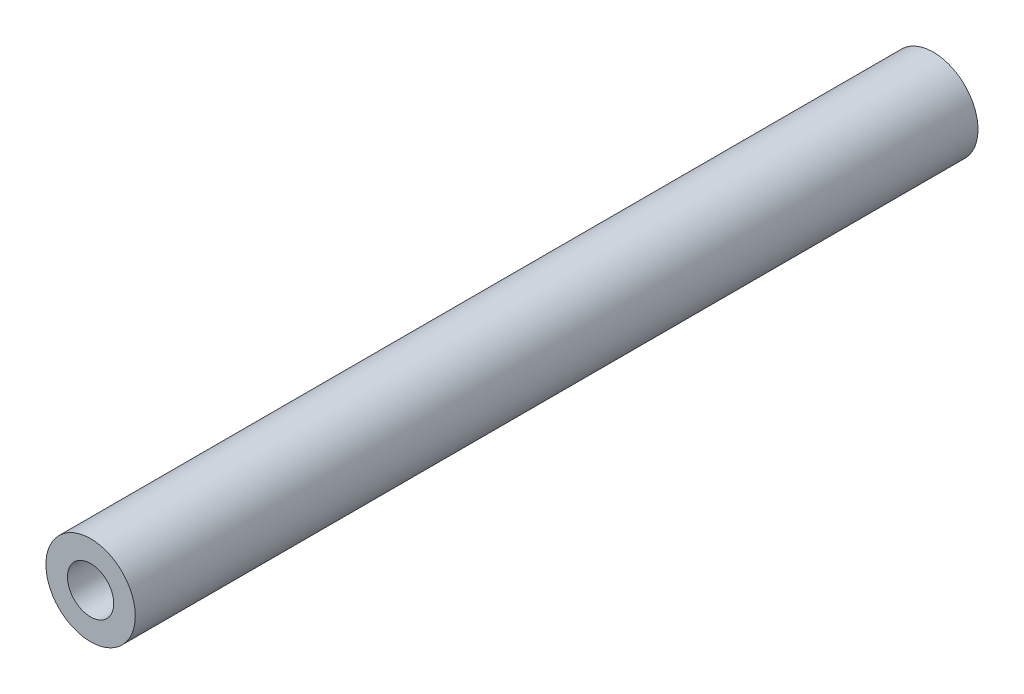
from build123d import *

# Parameters (mm, degrees)
SKETCH1_R                      = 5
BOSS_EXTRUDE1_DEPTH            = 94.3
F_6_0_204_DIAMETER_HOLE1_D     = 5.1816
F_6_0_204_DIAMETER_HOLE1_DEPTH = 30
F_6_0_204_DIAMETER_HOLE1_TIP   = 1.556709692
F_6_0_204_DIAMETER_HOLE2_D     = 5.1816
F_6_0_204_DIAMETER_HOLE2_DEPTH = 30
F_6_0_204_DIAMETER_HOLE2_TIP   = 1.556709692


with BuildPart() as part:
    # Sketch1 → Boss-Extrude1 (new body)
    with BuildSketch(Plane.XY):
        Circle(SKETCH1_R)
    extrude(amount=BOSS_EXTRUDE1_DEPTH)

    # #6 (0.204) Diameter Hole1
    with Locations(Plane(origin=(0, 0, 0), x_dir=(-1, 0, 0), z_dir=(0, 0, -1))):
        with Locations((0, 0)):
            Hole(F_6_0_204_DIAMETER_HOLE1_D / 2, depth=F_6_0_204_DIAMETER_HOLE1_DEPTH)
            with Locations((0, 0, -(F_6_0_204_DIAMETER_HOLE1_DEPTH + F_6_0_204_DIAMETER_HOLE1_TIP / 2))):  # 118° drill point
                Cone(0, F_6_0_204_DIAMETER_HOLE1_D / 2, F_6_0_204_DIAMETER_HOLE1_TIP, mode=Mode.SUBTRACT)

    # #6 (0.204) Diameter Hole2
    with Locations(Plane.XY.offset(94.3)):
        with Locations((0, 0)):
            Hole(F_6_0_204_DIAMETER_HOLE2_D / 2, depth=F_6_0_204_DIAMETER_HOLE2_DEPTH)
            with Locations((0, 0, -(F_6_0_204_DIAMETER_HOLE2_DEPTH + F_6_0_204_DIAMETER_HOLE2_TIP / 2))):  # 118° drill point
                Cone(0, F_6_0_204_DIAMETER_HOLE2_D / 2, F_6_0_204_DIAMETER_HOLE2_TIP, mode=Mode.SUBTRACT)


solid = part.part
